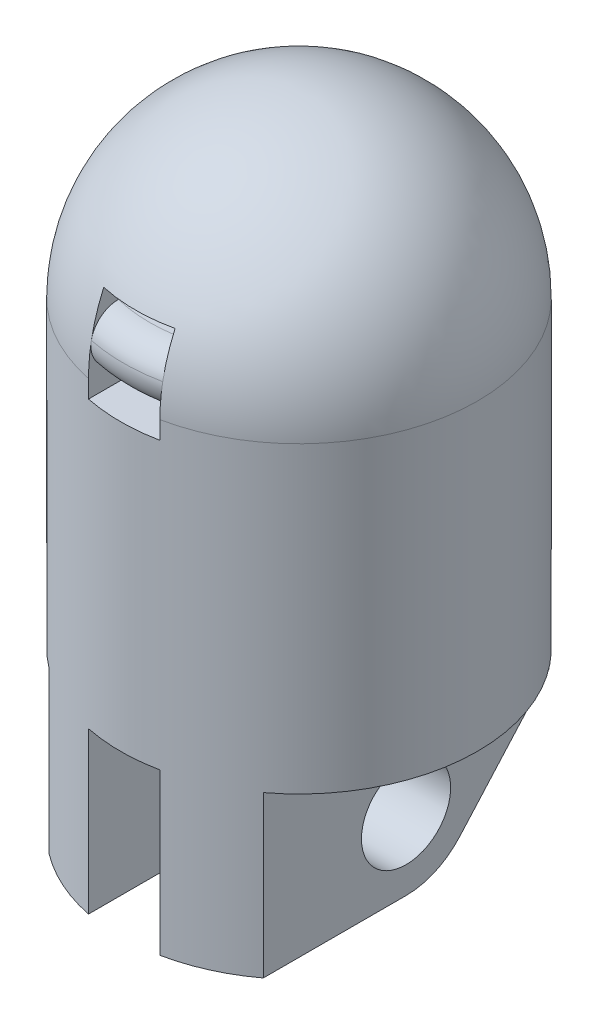
from build123d import *

# Parameters (mm, degrees)
CUT_EXTRUDE1_DEPTH      = 11.43
SKETCH3_R               = 3.175
CUT_EXTRUDE2_DEPTH      = 52.61889964
CUT_EXTRUDE3_DEPTH      = 50.121262199
CUT_EXTRUDE3_DEPTH_BACK = 50.121262199
SKETCH4_W               = 5.08
SKETCH4_H               = 1.27
FILLET1_R               = 1.905


with BuildPart() as part:
    # Sketch1 → Revolve1 (revolve)
    with BuildSketch(Plane.XY, mode=Mode.PRIVATE) as revolve1_sk:
        with BuildLine():
            Line((0, 0), (0, 5.602635041))
            Line((0, 5.602635041), (-2.54, 5.602635041))
            Line((-2.54, 5.602635041), (-2.54, 38.1))
            Line((-2.54, 38.1), (0, 38.1))
            Line((0, 38.1), (0, 45.72))
            ThreePointArc((0, 45.72), (-8.980256121, 42.000256121), (-12.7, 33.02))
            Line((-12.7, 33.02), (-12.7, 0))
            Line((-12.7, 0), (0, 0))
        make_face()
    revolve(revolve1_sk.sketch.rotate(Axis((0, 0, 0), (0, 1, 0)), 270), axis=Axis((0, 0, 0), (0, 1, 0)))

    # Sketch2 → Cut-Extrude1 (cut)
    with BuildSketch(Plane.XZ):
        with BuildLine():
            Line((-2.54, 12.443407893), (-2.54, -12.443407893))
            ThreePointArc((-2.54, -12.443407893), (0, -12.7), (2.54, -12.443407893))
            Line((2.54, -12.443407893), (2.54, 12.443407893))
            ThreePointArc((2.54, 12.443407893), (0, 12.7), (-2.54, 12.443407893))
        make_face()
        with BuildLine():
            Line((-7.62, 10.16), (-7.62, -10.16))
            ThreePointArc((-7.62, -10.16), (-12.7, 0), (-7.62, 10.16))
        make_face()
        with BuildLine():
            Line((7.62, 10.16), (7.62, -10.16))
            ThreePointArc((7.62, -10.16), (12.7, 0), (7.62, 10.16))
        make_face()
    extrude(amount=-CUT_EXTRUDE1_DEPTH, mode=Mode.SUBTRACT)

    # Sketch3 → Cut-Extrude2 (cut, through all)
    with BuildSketch(Plane.ZY.offset(7.62)):
        with Locations((0, 5.08)):
            Circle(SKETCH3_R)
        with BuildLine():
            Line((0, 0), (-12.443407893, 0))
            Line((-12.443407893, 0), (-12.443407893, 11.43))
            Line((-12.443407893, 11.43), (-3.796422114, 1.704562379))
            ThreePointArc((-3.796422114, 1.704562379), (-2.080766311, 0.445691901), (0, 0))
        make_face()
    extrude(amount=-CUT_EXTRUDE2_DEPTH, mode=Mode.SUBTRACT)

    # Sketch4 → Cut-Extrude3 (cut, two sides: drawn at the far end of the back side and taken through both)
    with BuildSketch(Plane.XY.offset(-CUT_EXTRUDE3_DEPTH_BACK)):
        with Locations((0, 32.385)):
            Rectangle(SKETCH4_W, SKETCH4_H)
        with Locations((0, 37.465)):
            Rectangle(SKETCH4_W, SKETCH4_H)
    extrude(amount=CUT_EXTRUDE3_DEPTH + CUT_EXTRUDE3_DEPTH_BACK, mode=Mode.SUBTRACT)

    # Fillet1
    # the kernel refuses this fillet: 1.905 mm, written as the material it takes off along each edge
    with BuildSketch(Plane(origin=(0, 33.02, 0), x_dir=(-0.60062876969462, 0, 0.7995280364159391), z_dir=(-0.7995280364159391, 0, -0.60062876969462))) as fillet1_piece_1_section:
        with BuildLine():
            CenterArc((10.625582337, 1.905), FILLET1_R, 270, 100.164248622)
            Line((10.625582337, 0), (12.7, 0))
            ThreePointArc((12.7, 0), (12.650073138, 1.125010933), (12.500685102, 2.241176471))
        make_face()
    fillet1_piece_1 = revolve(axis=Axis((0, 33.02, 0), (0, 1, 0)), revolution_arc=73.829886486, mode=Mode.PRIVATE)
    fillet1_piece_1 = split(fillet1_piece_1, bisect_by=Plane(origin=(2.54, 33.536908465, 12.1243087), z_dir=(-1, 0, 0)), keep=Keep.TOP, mode=Mode.PRIVATE)
    fillet1_piece_1 = split(fillet1_piece_1, bisect_by=Plane(origin=(-2.54, 33.536908465, 12.1243087), z_dir=(1, 0, 0)), keep=Keep.TOP, mode=Mode.PRIVATE)
    add(fillet1_piece_1, mode=Mode.SUBTRACT)
    with BuildSketch(Plane(origin=(0, 36.83, 0), x_dir=(0.5180820301307626, 0, 0.8553309359865265), z_dir=(0.8553309359865265, 0, -0.5180820301307626))) as fillet1_piece_2_section:
        with BuildLine():
            CenterArc((10.625582337, 1.905), FILLET1_R, 270, 79.835751378)
            Line((10.625582337, 0), (12.115027858, 0))
            ThreePointArc((12.115027858, 0), (12.332827452, 0.778273257), (12.500685102, 1.568823529))
        make_face()
    fillet1_piece_2 = revolve(axis=Axis((0, 36.83, 0), (0, -1, 0)), revolution_arc=62.407371172, mode=Mode.PRIVATE)
    fillet1_piece_2 = split(fillet1_piece_2, bisect_by=Plane(origin=(2.54, 36.48222625, 11.799196002), z_dir=(-1, 0, 0)), keep=Keep.TOP, mode=Mode.PRIVATE)
    fillet1_piece_2 = split(fillet1_piece_2, bisect_by=Plane(origin=(-2.54, 36.48222625, 11.799196002), z_dir=(1, 0, 0)), keep=Keep.TOP, mode=Mode.PRIVATE)
    add(fillet1_piece_2, mode=Mode.SUBTRACT)
    with BuildSketch(Plane(origin=(0, 36.83, 0), x_dir=(-0.5180758180945624, 0, -0.8553346986447176), z_dir=(-0.8553346986447176, 0, 0.5180758180945624))) as fillet1_piece_3_section:
        with BuildLine():
            CenterArc((10.625582337, 1.905), FILLET1_R, 270, 79.835751378)
            Line((10.625582337, 0), (12.115027858, 0))
            ThreePointArc((12.115027858, 0), (12.332827452, 0.778273257), (12.500685102, 1.568823529))
        make_face()
    fillet1_piece_3 = revolve(axis=Axis((0, 36.83, 0), (0, -1, 0)), revolution_arc=31.203269463, mode=Mode.PRIVATE)
    fillet1_piece_3 = split(fillet1_piece_3, bisect_by=Plane(origin=(-2.54, 36.482226182, -11.799196273), z_dir=(1, 0, 0)), keep=Keep.TOP, mode=Mode.PRIVATE)
    add(fillet1_piece_3, mode=Mode.SUBTRACT)
    with BuildSketch(Plane(origin=(0, 33.02, 0), x_dir=(0.6006217587640166, 0, -0.7995333031833131), z_dir=(0.7995333031833131, 0, 0.6006217587640166))) as fillet1_piece_4_section:
        with BuildLine():
            CenterArc((10.625582337, 1.905), FILLET1_R, 270, 100.164248622)
            Line((10.625582337, 0), (12.7, 0))
            ThreePointArc((12.7, 0), (12.650073138, 1.125010933), (12.500685102, 2.241176471))
        make_face()
    fillet1_piece_4 = revolve(axis=Axis((0, 33.02, 0), (0, 1, 0)), revolution_arc=36.914440828, mode=Mode.PRIVATE)
    fillet1_piece_4 = split(fillet1_piece_4, bisect_by=Plane(origin=(2.54, 33.536908471, -12.124308945), z_dir=(-1, 0, 0)), keep=Keep.TOP, mode=Mode.PRIVATE)
    add(fillet1_piece_4, mode=Mode.SUBTRACT)
    with BuildSketch(Plane(origin=(0, 33.02, 0), x_dir=(0, 0, -1), z_dir=(1, 0, 0))) as fillet1_piece_5_section:
        with BuildLine():
            CenterArc((10.625582337, 1.905), FILLET1_R, 270, 100.164248622)
            Line((10.625582337, 0), (12.7, 0))
            ThreePointArc((12.7, 0), (12.650073138, 1.125010933), (12.500685102, 2.241176471))
        make_face()
    fillet1_piece_5 = revolve(axis=Axis((0, 33.02, 0), (0, 1, 0)), revolution_arc=36.914440828, mode=Mode.PRIVATE)
    fillet1_piece_5 = split(fillet1_piece_5, bisect_by=Plane(origin=(-2.54, 33.536908442, -12.124308642), z_dir=(1, 0, 0)), keep=Keep.TOP, mode=Mode.PRIVATE)
    add(fillet1_piece_5, mode=Mode.SUBTRACT)
    with BuildSketch(Plane(origin=(0, 36.83, 0), x_dir=(0, 0, -1), z_dir=(-1, 0, 0))) as fillet1_piece_6_section:
        with BuildLine():
            CenterArc((10.625582337, 1.905), FILLET1_R, 270, 79.835751378)
            Line((10.625582337, 0), (12.115027858, 0))
            ThreePointArc((12.115027858, 0), (12.332827452, 0.778273257), (12.500685102, 1.568823529))
        make_face()
    fillet1_piece_6 = revolve(axis=Axis((0, 36.83, 0), (0, -1, 0)), revolution_arc=31.203269463, mode=Mode.PRIVATE)
    fillet1_piece_6 = split(fillet1_piece_6, bisect_by=Plane(origin=(2.54, 36.482226255, -11.799195907), z_dir=(-1, 0, 0)), keep=Keep.TOP, mode=Mode.PRIVATE)
    add(fillet1_piece_6, mode=Mode.SUBTRACT)


solid = part.part
